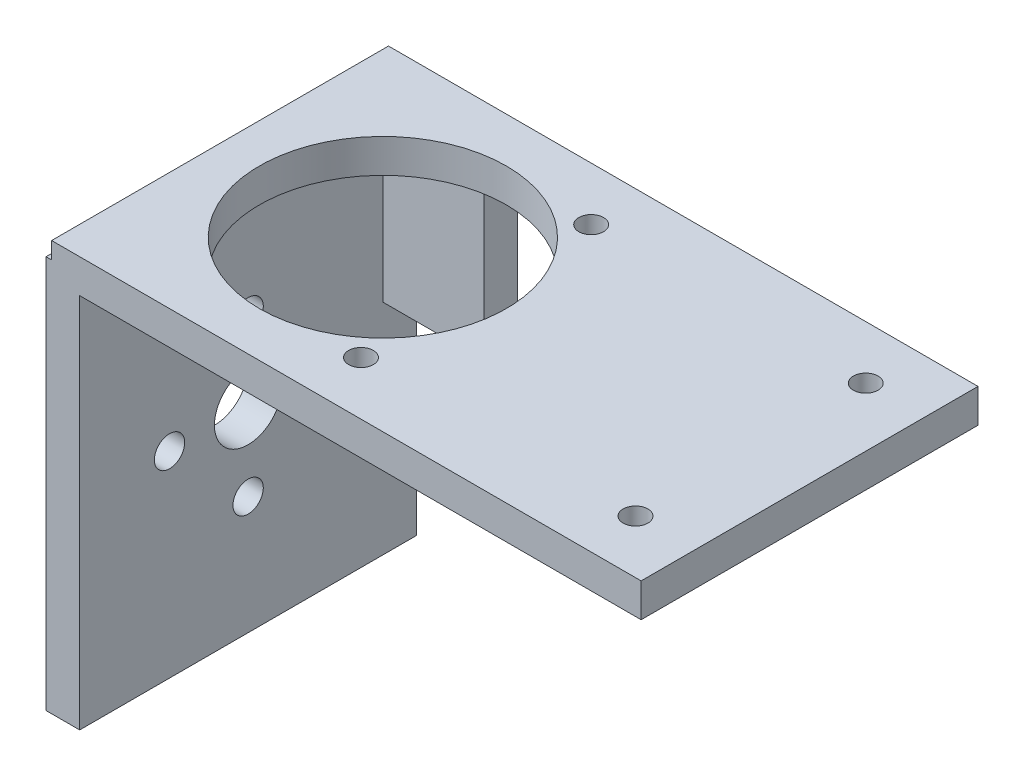
from build123d import *

# Parameters (mm, degrees)
S_BOX1_W      = 3
S_BOX1_H      = 35
BOSS_1_DEPTH  = 30
S_BOX2_W      = 52.5
S_BOX2_H      = 3
BOSS_2_DEPTH  = 30
S_BOX3_W      = 11.5
S_BOX3_H      = 16.5
BOSS_3_DEPTH  = 3
S_HOLE4_R     = 3
HOLE_4_DEPTH  = 3.2
S_HOLE5_R     = 1.35
HOLE_5_DEPTH  = 3.2
S_HOLE6_R     = 1.35
HOLE_6_DEPTH  = 3.2
S_HOLE7_R     = 1.35
HOLE_7_DEPTH  = 3.2
S_HOLE8_R     = 1.35
HOLE_8_DEPTH  = 3.2
S_HOLE9_R     = 11
HOLE_9_DEPTH  = 3.2
S_HOLE10_R    = 1.1
HOLE_10_DEPTH = 3.2
S_HOLE11_R    = 1.1
HOLE_11_DEPTH = 3.2
S_HOLE12_R    = 1.1
HOLE_12_DEPTH = 3.2
S_HOLE13_R    = 1.1
HOLE_13_DEPTH = 3.2


with BuildPart() as part:
    # S_box1 → Boss_1 (new body)
    with BuildSketch(Plane.XY.offset(-15)):
        with Locations((-13.5, 0)):
            Rectangle(S_BOX1_W, S_BOX1_H)
    extrude(amount=BOSS_1_DEPTH)

    # S_box2 → Boss_2 (add)
    with BuildSketch(Plane.XY.offset(-15)):
        with Locations((11.75, 17.5)):
            Rectangle(S_BOX2_W, S_BOX2_H)
    extrude(amount=BOSS_2_DEPTH)

    # S_box3 → Boss_3 (add)
    with BuildSketch(Plane.XY.offset(-15)):
        with Locations((-8.75, 10.25)):
            Rectangle(S_BOX3_W, S_BOX3_H)
    extrude(amount=BOSS_3_DEPTH)

    # S_hole4 → Hole_4 (cut)
    with BuildSketch(Plane(origin=(-15.1, 0, 0), x_dir=(0, 0, -1), z_dir=(1, 0, 0))):
        Circle(S_HOLE4_R)
    extrude(amount=HOLE_4_DEPTH, mode=Mode.SUBTRACT)

    # S_hole5 → Hole_5 (cut)
    with BuildSketch(Plane(origin=(-15.1, 0, 0), x_dir=(0, 0, -1), z_dir=(1, 0, 0))):
        with Locations((0, -7)):
            Circle(S_HOLE5_R)
    extrude(amount=HOLE_5_DEPTH, mode=Mode.SUBTRACT)

    # S_hole6 → Hole_6 (cut)
    with BuildSketch(Plane(origin=(-15.1, 0, 0), x_dir=(0, 0, -1), z_dir=(1, 0, 0))):
        with Locations((-7, 0)):
            Circle(S_HOLE6_R)
    extrude(amount=HOLE_6_DEPTH, mode=Mode.SUBTRACT)

    # S_hole7 → Hole_7 (cut)
    with BuildSketch(Plane(origin=(-15.1, 0, 0), x_dir=(0, 0, -1), z_dir=(1, 0, 0))):
        with Locations((0, 7)):
            Circle(S_HOLE7_R)
    extrude(amount=HOLE_7_DEPTH, mode=Mode.SUBTRACT)

    # S_hole8 → Hole_8 (cut)
    with BuildSketch(Plane(origin=(-15.1, 0, 0), x_dir=(0, 0, -1), z_dir=(1, 0, 0))):
        with Locations((7, 0)):
            Circle(S_HOLE8_R)
    extrude(amount=HOLE_8_DEPTH, mode=Mode.SUBTRACT)

    # S_hole9 → Hole_9 (cut)
    with BuildSketch(Plane(origin=(0, 15.9, 0), x_dir=(1, 0, 0), z_dir=(0, 1, 0))):
        Circle(S_HOLE9_R)
    extrude(amount=HOLE_9_DEPTH, mode=Mode.SUBTRACT)

    # S_hole10 → Hole_10 (cut)
    with BuildSketch(Plane(origin=(0, 15.9, 0), x_dir=(1, 0, 0), z_dir=(0, 1, 0))):
        with Locations((8.3, 10.25)):
            Circle(S_HOLE10_R)
    extrude(amount=HOLE_10_DEPTH, mode=Mode.SUBTRACT)

    # S_hole11 → Hole_11 (cut)
    with BuildSketch(Plane(origin=(0, 15.9, 0), x_dir=(1, 0, 0), z_dir=(0, 1, 0))):
        with Locations((8.3, -10.25)):
            Circle(S_HOLE11_R)
    extrude(amount=HOLE_11_DEPTH, mode=Mode.SUBTRACT)

    # S_hole12 → Hole_12 (cut)
    with BuildSketch(Plane(origin=(0, 15.9, 0), x_dir=(1, 0, 0), z_dir=(0, 1, 0))):
        with Locations((32.75, 10.25)):
            Circle(S_HOLE12_R)
    extrude(amount=HOLE_12_DEPTH, mode=Mode.SUBTRACT)

    # S_hole13 → Hole_13 (cut)
    with BuildSketch(Plane(origin=(0, 15.9, 0), x_dir=(1, 0, 0), z_dir=(0, 1, 0))):
        with Locations((32.75, -10.25)):
            Circle(S_HOLE13_R)
    extrude(amount=HOLE_13_DEPTH, mode=Mode.SUBTRACT)


solid = part.part
